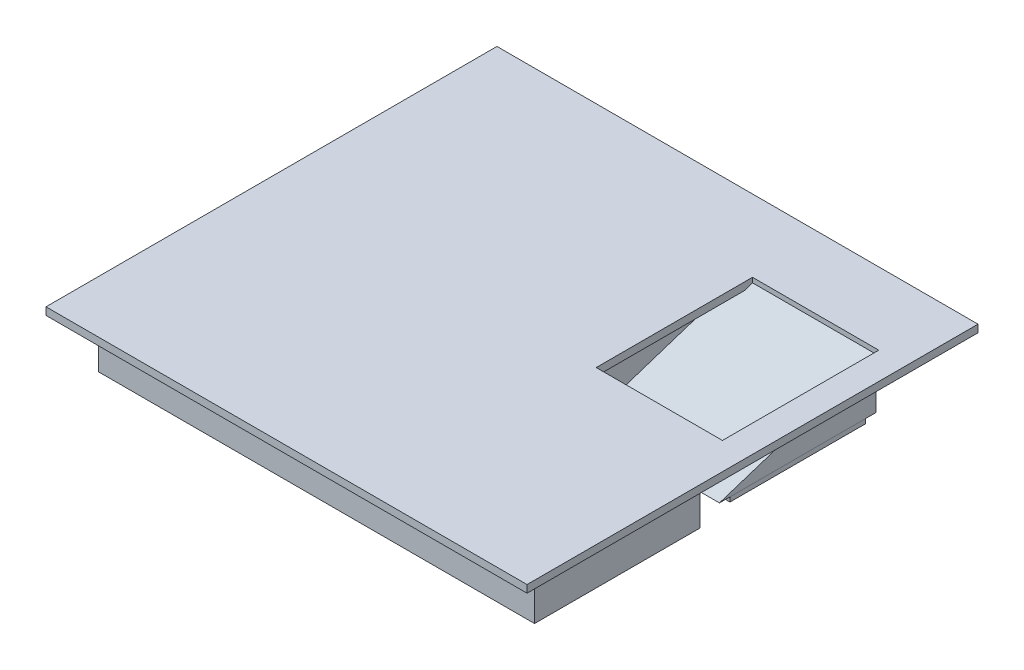
from build123d import *

# Parameters (mm, degrees)
SKETCH1_W           = 320
SKETCH1_H           = 300
BOSS_EXTRUDE1_DEPTH = 5
SKETCH2_W           = 80
SKETCH2_H           = 90
SKETCH2_W_2         = 290
SKETCH2_H_2         = 110
BOSS_EXTRUDE2_DEPTH = 40
SKETCH11_W          = 84
SKETCH11_H          = 104
CUT_EXTRUDE3_DEPTH  = 37
BOSS_EXTRUDE4_DEPTH = 90


with BuildPart() as part:
    # Sketch1 → Boss-Extrude1 (new body)
    with BuildSketch(Plane(origin=(0, 0, 0), x_dir=(1, 0, 0), z_dir=(0, 1, 0))):
        with Locations((160, 150)):
            Rectangle(SKETCH1_W, SKETCH1_H)
    extrude(amount=BOSS_EXTRUDE1_DEPTH)

    # Sketch2 → Boss-Extrude2 (add)
    with BuildSketch(Plane(origin=(0, 5, 0), x_dir=(1, 0, 0), z_dir=(0, 1, 0))):
        with Locations((60, 200)):
            Rectangle(SKETCH2_W, SKETCH2_H)
        with Locations((160, 200)):
            Rectangle(SKETCH2_W, SKETCH2_H)
        with Locations((260, 200)):
            Rectangle(SKETCH2_W, SKETCH2_H)
        with Locations((160, 75)):
            Rectangle(SKETCH2_W_2, SKETCH2_H_2)
    extrude(amount=-BOSS_EXTRUDE2_DEPTH)

    # Sketch11 → Cut-Extrude3 (cut)
    with BuildSketch(Plane(origin=(0, 5, 0), x_dir=(1, 0, 0), z_dir=(0, 1, 0))):
        with Locations((260, 200)):
            Rectangle(SKETCH11_W, SKETCH11_H)
    extrude(amount=-CUT_EXTRUDE3_DEPTH, mode=Mode.SUBTRACT)


with BuildPart() as cut_extrude3_piece_1:
    # of the separate pieces the step leaves, piece 1, a body of its own (cut_extrude3_pieces)
    add(part.part.solids().sort_by_distance((0, 0, 0))[0])

    # Sketch13 → Boss-Extrude4 (add)
    with BuildSketch(Plane(origin=(300, 0, 0), x_dir=(0, 0, -1), z_dir=(1, 0, 0))):
        Polygon((148, -32), (252, 1.791648408), (252, -32), align=None)
    extrude(amount=-BOSS_EXTRUDE4_DEPTH)


with BuildPart() as cut_extrude3_piece_2:
    # of the separate pieces the step leaves, piece 2, a body of its own (cut_extrude3_pieces)
    add(part.part.solids().sort_by_distance((220, -32, -155))[0])


solid = Compound([cut_extrude3_piece_1.part, cut_extrude3_piece_2.part])
